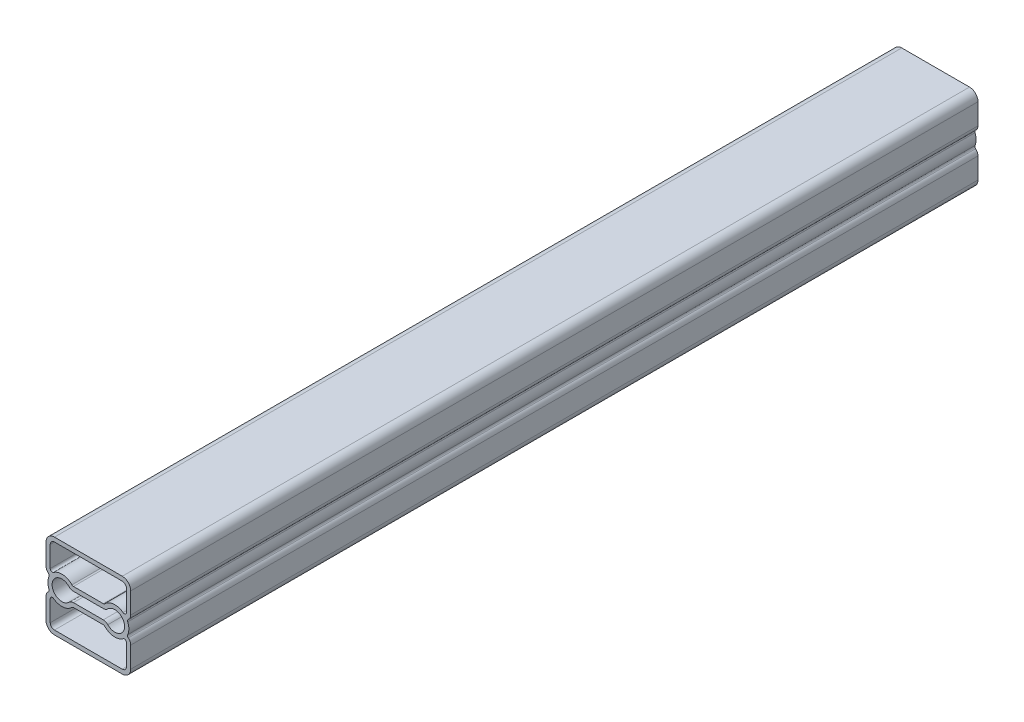
from build123d import *

# Parameters (mm, degrees)
BOSS_EXTRUDE1_DEPTH = 254


with BuildPart() as part:
    # Sketch1 → Boss-Extrude1 (new body)
    with BuildSketch(Plane.XY):
        with BuildLine():
            Line((12.7, 3.904831807), (12.7, 10.16))
            ThreePointArc((12.7, 10.16), (11.956051224, 11.956051224), (10.16, 12.7))
            Line((10.16, 12.7), (-10.16, 12.7))
            ThreePointArc((-10.16, 12.7), (-11.956051224, 11.956051224), (-12.7, 10.16))
            Line((-12.7, 10.16), (-12.7, 3.904831807))
            ThreePointArc((-12.7, 3.904831807), (-12.511460601, 3.078521934), (-11.983162199, 2.415773182))
            ThreePointArc((-11.983162199, 2.415773182), (-11.763134535, 2.073265365), (-11.796313868, 1.667527878))
            ThreePointArc((-11.796313868, 1.667527878), (-12.1412, 0), (-11.796313868, -1.667527878))
            ThreePointArc((-11.796313868, -1.667527878), (-11.763134535, -2.073265365), (-11.983162199, -2.415773182))
            ThreePointArc((-11.983162199, -2.415773182), (-12.511460601, -3.078521934), (-12.7, -3.904831807))
            Line((-12.7, -3.904831807), (-12.7, -10.16))
            ThreePointArc((-12.7, -10.16), (-11.956051224, -11.956051224), (-10.16, -12.7))
            Line((-10.16, -12.7), (10.16, -12.7))
            ThreePointArc((10.16, -12.7), (11.956051224, -11.956051224), (12.7, -10.16))
            Line((12.7, -10.16), (12.7, -3.904831807))
            ThreePointArc((12.7, -3.904831807), (12.511460601, -3.078521934), (11.983162199, -2.415773182))
            ThreePointArc((11.983162199, -2.415773182), (11.763134535, -2.073265365), (11.796313868, -1.667527878))
            ThreePointArc((11.796313868, -1.667527878), (12.1412, 0), (11.796313868, 1.667527878))
            ThreePointArc((11.796313868, 1.667527878), (11.763134535, 2.073265365), (11.983162199, 2.415773182))
            ThreePointArc((11.983162199, 2.415773182), (12.511460601, 3.078521934), (12.7, 3.904831807))
        make_face()
        with BuildLine():
            Line((4.467104451, -1.46685), (-4.467104451, -1.46685))
            ThreePointArc((-4.467104451, -1.46685), (-5.208770649, -1.617154514), (-5.833401911, -2.04435))
            ThreePointArc((-5.833401911, -2.04435), (-10.8712, 0), (-5.833401911, 2.04435))
            ThreePointArc((-5.833401911, 2.04435), (-5.208770649, 1.617154514), (-4.467104451, 1.46685))
            Line((-4.467104451, 1.46685), (4.467104451, 1.46685))
            ThreePointArc((4.467104451, 1.46685), (5.208770649, 1.617154514), (5.833401911, 2.04435))
            ThreePointArc((5.833401911, 2.04435), (10.8712, 0), (5.833401911, -2.04435))
            ThreePointArc((5.833401911, -2.04435), (5.208770649, -1.617154514), (4.467104451, -1.46685))
        make_face(mode=Mode.SUBTRACT)
        with BuildLine():
            Line((11.43, 10.16), (11.43, 3.904831807))
            ThreePointArc((11.43, 3.904831807), (11.082315158, 3.338550075), (10.42, 3.392386688))
            ThreePointArc((10.42, 3.392386688), (7.584682807, 4.188867833), (4.922536938, 2.92935))
            ThreePointArc((4.922536938, 2.92935), (4.714326517, 2.786951505), (4.467104451, 2.73685))
            Line((4.467104451, 2.73685), (-4.467104451, 2.73685))
            ThreePointArc((-4.467104451, 2.73685), (-4.714326517, 2.786951505), (-4.922536938, 2.92935))
            ThreePointArc((-4.922536938, 2.92935), (-7.584682807, 4.188867833), (-10.42, 3.392386688))
            ThreePointArc((-10.42, 3.392386688), (-11.082315158, 3.338550075), (-11.43, 3.904831807))
            Line((-11.43, 3.904831807), (-11.43, 10.16))
            ThreePointArc((-11.43, 10.16), (-11.058025612, 11.058025612), (-10.16, 11.43))
            Line((-10.16, 11.43), (10.16, 11.43))
            ThreePointArc((10.16, 11.43), (11.058025612, 11.058025612), (11.43, 10.16))
        make_face(mode=Mode.SUBTRACT)
        with BuildLine():
            Line((11.43, -3.904831807), (11.43, -10.16))
            ThreePointArc((11.43, -10.16), (11.058025612, -11.058025612), (10.16, -11.43))
            Line((10.16, -11.43), (-10.16, -11.43))
            ThreePointArc((-10.16, -11.43), (-11.058025612, -11.058025612), (-11.43, -10.16))
            Line((-11.43, -10.16), (-11.43, -3.904831807))
            ThreePointArc((-11.43, -3.904831807), (-11.082315158, -3.338550075), (-10.42, -3.392386688))
            ThreePointArc((-10.42, -3.392386688), (-7.584682807, -4.188867833), (-4.922536938, -2.92935))
            ThreePointArc((-4.922536938, -2.92935), (-4.714326517, -2.786951505), (-4.467104451, -2.73685))
            Line((-4.467104451, -2.73685), (4.467104451, -2.73685))
            ThreePointArc((4.467104451, -2.73685), (4.714326517, -2.786951505), (4.922536938, -2.92935))
            ThreePointArc((4.922536938, -2.92935), (7.584682807, -4.188867833), (10.42, -3.392386688))
            ThreePointArc((10.42, -3.392386688), (11.082315158, -3.338550075), (11.43, -3.904831807))
        make_face(mode=Mode.SUBTRACT)
    extrude(amount=-BOSS_EXTRUDE1_DEPTH)


solid = part.part
